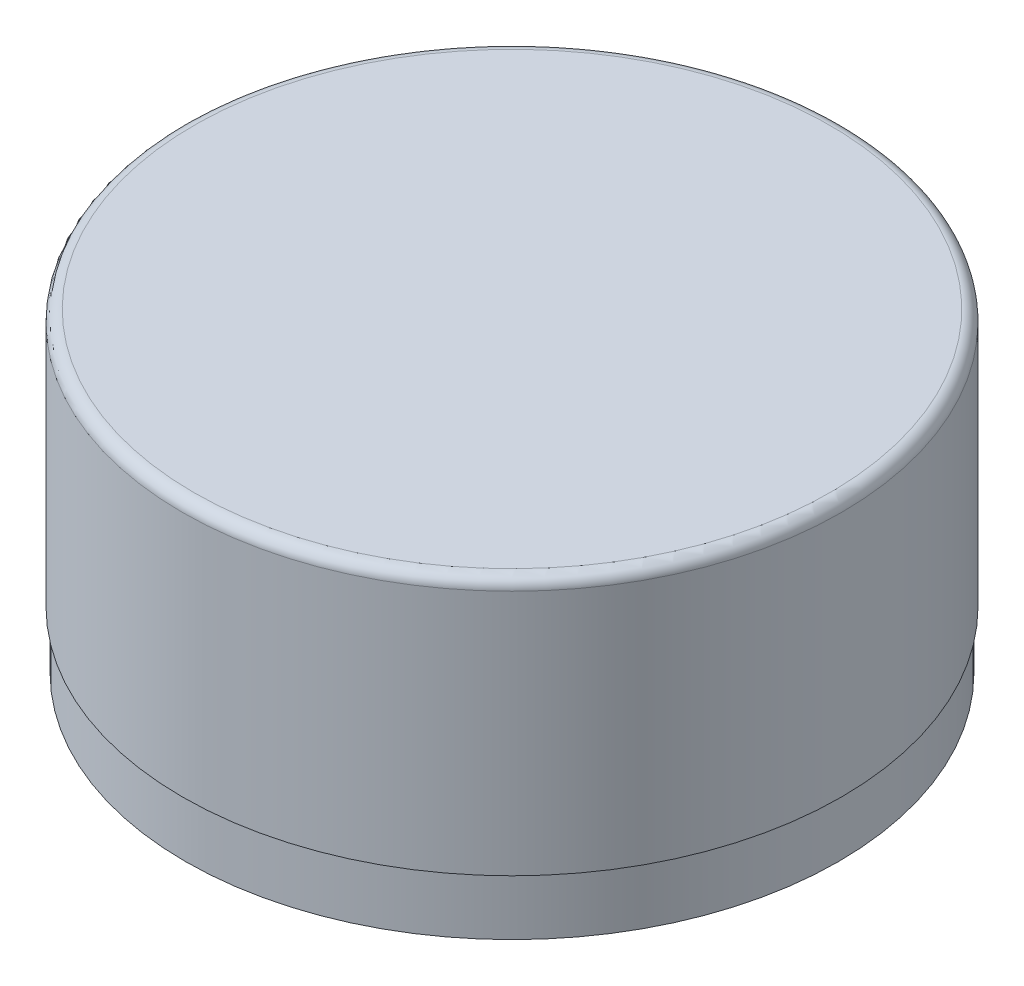
from build123d import *

# Parameters (mm, degrees)
SKETCH7_R           = 5.7
BOSS_EXTRUDE2_DEPTH = 1
SKETCH8_R           = 5.75
BOSS_EXTRUDE3_DEPTH = 4.5
FILLET4_R           = 0.2
SKETCH9_W           = 5
SKETCH9_H           = 5
BOSS_EXTRUDE4_DEPTH = 0.1
SHELL3_T            = -0.6


with BuildPart() as part:
    # Sketch7 → Boss-Extrude2 (new body)
    with BuildSketch(Plane(origin=(0, 0, 0), x_dir=(1, 0, 0), z_dir=(0, 1, 0))):
        Circle(SKETCH7_R)
    extrude(amount=BOSS_EXTRUDE2_DEPTH)

    # Sketch8 → Boss-Extrude3 (add)
    with BuildSketch(Plane(origin=(0, 1, 0), x_dir=(1, 0, 0), z_dir=(0, 1, 0))):
        Circle(SKETCH8_R)
    extrude(amount=BOSS_EXTRUDE3_DEPTH)

    # Fillet4
    fillet4_edges = [part.edges().sort_by_distance(p)[0] for p in [
        (-5.75, 5.5, 0),
    ]]
    fillet(fillet4_edges, radius=FILLET4_R)

    # Sketch9 → Boss-Extrude4 (add)
    with BuildSketch(Plane.XZ):
        Rectangle(SKETCH9_W, SKETCH9_H)
    extrude(amount=BOSS_EXTRUDE4_DEPTH)

    # Shell3
    shell3_openings = [part.faces().sort_by_distance(p)[0] for p in [
        (0, -0.1, 0),
    ]]
    offset(amount=SHELL3_T, openings=shell3_openings, kind=Kind.INTERSECTION)


solid = part.part
